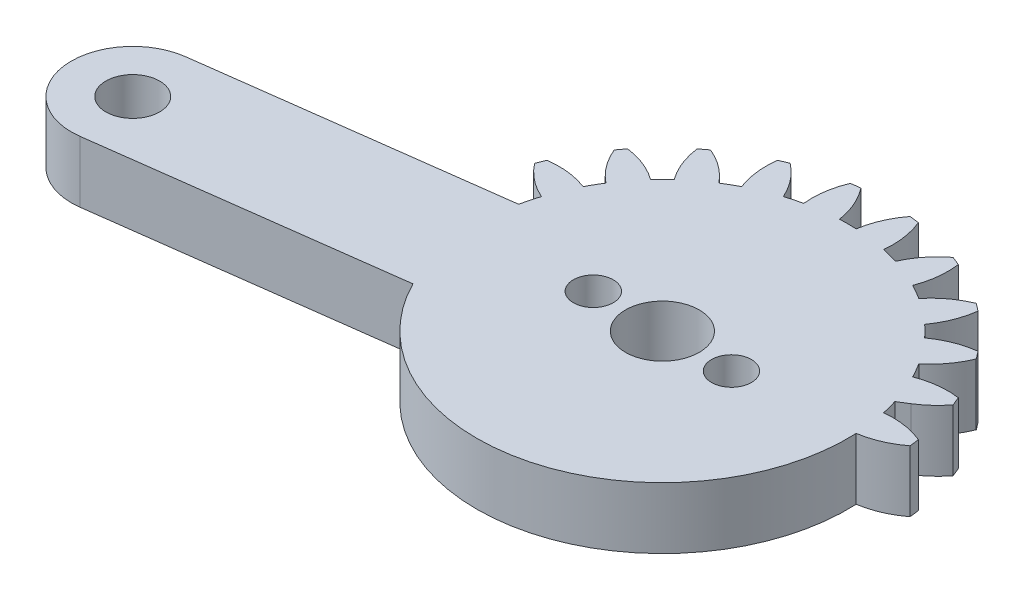
from build123d import *
from build123d.topology import SkipClean

# Parameters (mm, degrees)
SKETCH1_R           = 1.5
BOSS_EXTRUDE1_DEPTH = 4
BOSS_EXTRUDE2_START = -4
SKETCH3_R           = 1.5
SKETCH3_R_2         = 1.75
BOSS_EXTRUDE2_DEPTH = 4
CUT_EXTRUDE1_START  = -4
CUT_EXTRUDE1_DEPTH  = 4
CUT_EXTRUDE2_REACH  = 49.073
SKETCH5_R           = 2.4
SKETCH5_R_2         = 1.3


with BuildPart() as part:
    # Sketch1 → Boss-Extrude1 (new body)
    with BuildSketch(Plane(origin=(0, 0, 0), x_dir=(1, 0, 0), z_dir=(0, 1, 0))):
        with BuildLine():
            Line((20.643657446, 4), (2.081641936, 4))
            ThreePointArc((2.081641936, 4), (2.861028333, 4.588201733), (3.521749436, 5.30713988))
            ThreePointArc((3.521749436, 5.30713988), (3.405395609, 5.596745198), (3.282888305, 5.883801663))
            ThreePointArc((3.282888305, 5.883801663), (1.93527598, 5.894040025), (0.627094961, 5.57027124))
            ThreePointArc((0.627094961, 5.57027124), (0.366286148, 6.046375), (0.084372603, 6.510293938))
            ThreePointArc((0.084372603, 6.510293938), (1.018855105, 7.48132754), (1.683794586, 8.65351323))
            ThreePointArc((1.683794586, 8.65351323), (1.496450048, 8.903135899), (1.303821399, 9.148703928))
            ThreePointArc((1.303821399, 9.148703928), (-0.000522033, 8.809805691), (-1.180330337, 8.158486898))
            ThreePointArc((-1.180330337, 8.158486898), (-1.555477026, 8.550865528), (-1.947855656, 8.926012217))
            ThreePointArc((-1.947855656, 8.926012217), (-1.296536862, 10.105820521), (-0.957638625, 11.410163953))
            ThreePointArc((-0.957638625, 11.410163953), (-1.203206655, 11.602792602), (-1.452829324, 11.79013714))
            ThreePointArc((-1.452829324, 11.79013714), (-2.625015014, 11.125197659), (-3.596048616, 10.190715157))
            ThreePointArc((-3.596048616, 10.190715157), (-4.059967554, 10.472628702), (-4.536071314, 10.733437515))
            ThreePointArc((-4.536071314, 10.733437515), (-4.212302529, 12.041618533), (-4.222540891, 13.389230859))
            ThreePointArc((-4.222540891, 13.389230859), (-4.509597355, 13.511738163), (-4.799202674, 13.62809199))
            ThreePointArc((-4.799202674, 13.62809199), (-5.759348103, 12.682425791), (-6.455432668, 11.528463019))
            ThreePointArc((-6.455432668, 11.528463019), (-6.976508546, 11.680699536), (-7.503891752, 11.809396783))
            ThreePointArc((-7.503891752, 11.809396783), (-7.529737283, 13.156800143), (-7.888414517, 14.455843809))
            ThreePointArc((-7.888414517, 14.455843809), (-8.197396993, 14.499881098), (-8.507248835, 14.537314892))
            ThreePointArc((-8.507248835, 14.537314892), (-9.18992168, 13.375367565), (-9.563620196, 12.080565177))
            ThreePointArc((-9.563620196, 12.080565177), (-10.106342554, 12.09275), (-10.649064912, 12.080565177))
            ThreePointArc((-10.649064912, 12.080565177), (-11.022763428, 13.375367565), (-11.705436272, 14.537314892))
            ThreePointArc((-11.705436272, 14.537314892), (-12.015288115, 14.499881098), (-12.324270591, 14.455843809))
            ThreePointArc((-12.324270591, 14.455843809), (-12.682947825, 13.156800143), (-12.708793355, 11.809396783))
            ThreePointArc((-12.708793355, 11.809396783), (-13.236176561, 11.680699536), (-13.757252439, 11.528463019))
            ThreePointArc((-13.757252439, 11.528463019), (-14.453337005, 12.682425791), (-15.413482434, 13.62809199))
            ThreePointArc((-15.413482434, 13.62809199), (-15.703087752, 13.511738163), (-15.990144217, 13.389230859))
            ThreePointArc((-15.990144217, 13.389230859), (-16.000382579, 12.041618533), (-15.676613793, 10.733437515))
            ThreePointArc((-15.676613793, 10.733437515), (-16.152717554, 10.472628702), (-16.616636492, 10.190715157))
            ThreePointArc((-16.616636492, 10.190715157), (-17.587670094, 11.125197659), (-18.759855783, 11.79013714))
            ThreePointArc((-18.759855783, 11.79013714), (-19.009478453, 11.602792602), (-19.255046482, 11.410163953))
            ThreePointArc((-19.255046482, 11.410163953), (-18.916148245, 10.105820521), (-18.264829452, 8.926012217))
            ThreePointArc((-18.264829452, 8.926012217), (-18.657208082, 8.550865528), (-19.032354771, 8.158486898))
            ThreePointArc((-19.032354771, 8.158486898), (-20.212163074, 8.809805691), (-21.516506507, 9.148703928))
            ThreePointArc((-21.516506507, 9.148703928), (-21.709135156, 8.903135899), (-21.896479694, 8.65351323))
            ThreePointArc((-21.896479694, 8.65351323), (-21.231540213, 7.48132754), (-20.297057711, 6.510293938))
            ThreePointArc((-20.297057711, 6.510293938), (-20.578971255, 6.046375), (-20.839780068, 5.57027124))
            ThreePointArc((-20.839780068, 5.57027124), (-22.147961087, 5.894040025), (-23.495573413, 5.883801663))
            ThreePointArc((-23.495573413, 5.883801663), (-23.618080717, 5.596745198), (-23.734434544, 5.30713988))
            ThreePointArc((-23.734434544, 5.30713988), (-22.788768345, 4.346994451), (-21.634805572, 3.650909885))
            ThreePointArc((-21.634805572, 3.650909885), (-21.78704209, 3.129834008), (-21.915739337, 2.602450802))
            ThreePointArc((-21.915739337, 2.602450802), (-23.263142697, 2.576605271), (-24.562186363, 2.217928037))
            ThreePointArc((-24.562186363, 2.217928037), (-24.606223651, 1.908945561), (-24.643657446, 1.599093719))
            ThreePointArc((-24.643657446, 1.599093719), (-23.481710119, 0.916420874), (-22.186907731, 0.542722358))
            ThreePointArc((-22.186907731, 0.542722358), (-22.199092554, 0), (-22.186907731, -0.542722358))
            ThreePointArc((-22.186907731, -0.542722358), (-23.481710119, -0.916420874), (-24.643657446, -1.599093719))
            ThreePointArc((-24.643657446, -1.599093719), (-24.606223651, -1.908945561), (-24.562186363, -2.217928037))
            ThreePointArc((-24.562186363, -2.217928037), (-23.263142697, -2.576605271), (-21.915739337, -2.602450802))
            ThreePointArc((-21.915739337, -2.602450802), (-21.78704209, -3.129834008), (-21.634805572, -3.650909885))
            ThreePointArc((-21.634805572, -3.650909885), (-22.788768345, -4.346994451), (-23.734434544, -5.30713988))
            ThreePointArc((-23.734434544, -5.30713988), (-23.618080717, -5.596745198), (-23.495573413, -5.883801663))
            ThreePointArc((-23.495573413, -5.883801663), (-22.147961087, -5.894040025), (-20.839780068, -5.57027124))
            ThreePointArc((-20.839780068, -5.57027124), (-20.578971255, -6.046375), (-20.297057711, -6.510293938))
            ThreePointArc((-20.297057711, -6.510293938), (-21.231540213, -7.48132754), (-21.896479694, -8.65351323))
            ThreePointArc((-21.896479694, -8.65351323), (-21.709135156, -8.903135899), (-21.516506507, -9.148703928))
            ThreePointArc((-21.516506507, -9.148703928), (-20.212163074, -8.809805691), (-19.032354771, -8.158486898))
            ThreePointArc((-19.032354771, -8.158486898), (-18.657208082, -8.550865528), (-18.264829452, -8.926012217))
            ThreePointArc((-18.264829452, -8.926012217), (-18.916148245, -10.105820521), (-19.255046482, -11.410163953))
            ThreePointArc((-19.255046482, -11.410163953), (-19.009478453, -11.602792602), (-18.759855783, -11.79013714))
            ThreePointArc((-18.759855783, -11.79013714), (-17.587670094, -11.125197659), (-16.616636492, -10.190715157))
            ThreePointArc((-16.616636492, -10.190715157), (-16.152717554, -10.472628702), (-15.676613793, -10.733437515))
            ThreePointArc((-15.676613793, -10.733437515), (-16.000382579, -12.041618533), (-15.990144217, -13.389230859))
            ThreePointArc((-15.990144217, -13.389230859), (-15.703087752, -13.511738163), (-15.413482434, -13.62809199))
            ThreePointArc((-15.413482434, -13.62809199), (-14.453337005, -12.682425791), (-13.757252439, -11.528463019))
            ThreePointArc((-13.757252439, -11.528463019), (-13.236176561, -11.680699536), (-12.708793355, -11.809396783))
            ThreePointArc((-12.708793355, -11.809396783), (-12.682947825, -13.156800143), (-12.324270591, -14.455843809))
            ThreePointArc((-12.324270591, -14.455843809), (-12.015288115, -14.499881098), (-11.705436272, -14.537314892))
            ThreePointArc((-11.705436272, -14.537314892), (-11.022763428, -13.375367565), (-10.649064912, -12.080565177))
            ThreePointArc((-10.649064912, -12.080565177), (-10.106342554, -12.09275), (-9.563620196, -12.080565177))
            ThreePointArc((-9.563620196, -12.080565177), (-9.18992168, -13.375367565), (-8.507248835, -14.537314892))
            ThreePointArc((-8.507248835, -14.537314892), (-8.197396993, -14.499881098), (-7.888414517, -14.455843809))
            ThreePointArc((-7.888414517, -14.455843809), (-7.529737283, -13.156800143), (-7.503891752, -11.809396783))
            ThreePointArc((-7.503891752, -11.809396783), (-6.976508546, -11.680699536), (-6.455432668, -11.528463019))
            ThreePointArc((-6.455432668, -11.528463019), (-5.759348103, -12.682425791), (-4.799202674, -13.62809199))
            ThreePointArc((-4.799202674, -13.62809199), (-4.509597355, -13.511738163), (-4.222540891, -13.389230859))
            ThreePointArc((-4.222540891, -13.389230859), (-4.212302529, -12.041618533), (-4.536071314, -10.733437515))
            ThreePointArc((-4.536071314, -10.733437515), (-4.059967554, -10.472628702), (-3.596048616, -10.190715157))
            ThreePointArc((-3.596048616, -10.190715157), (-2.625015014, -11.125197659), (-1.452829324, -11.79013714))
            ThreePointArc((-1.452829324, -11.79013714), (-1.203206655, -11.602792602), (-0.957638625, -11.410163953))
            ThreePointArc((-0.957638625, -11.410163953), (-1.296536862, -10.105820521), (-1.947855656, -8.926012217))
            ThreePointArc((-1.947855656, -8.926012217), (-1.555477026, -8.550865528), (-1.180330337, -8.158486898))
            ThreePointArc((-1.180330337, -8.158486898), (-0.000522033, -8.809805691), (1.303821399, -9.148703928))
            ThreePointArc((1.303821399, -9.148703928), (1.496450048, -8.903135899), (1.683794586, -8.65351323))
            ThreePointArc((1.683794586, -8.65351323), (1.018855105, -7.48132754), (0.084372603, -6.510293938))
            ThreePointArc((0.084372603, -6.510293938), (0.366286148, -6.046375), (0.627094961, -5.57027124))
            ThreePointArc((0.627094961, -5.57027124), (1.93527598, -5.894040025), (3.282888305, -5.883801663))
            ThreePointArc((3.282888305, -5.883801663), (3.405395609, -5.596745198), (3.521749436, -5.30713988))
            ThreePointArc((3.521749436, -5.30713988), (2.861028333, -4.588201733), (2.081641936, -4))
            Line((2.081641936, -4), (20.643657446, -4))
            ThreePointArc((20.643657446, -4), (24.643657446, 0), (20.643657446, 4))
        make_face()
        with Locations((-10.106342554, 0)):
            Circle(SKETCH1_R, mode=Mode.SUBTRACT)
        with Locations((20.643657446, 0)):
            Circle(SKETCH1_R, mode=Mode.SUBTRACT)
    extrude(amount=BOSS_EXTRUDE1_DEPTH)

    # Sketch3 → Boss-Extrude2 (add)
    with BuildSketch(Plane(origin=(0, 4, 0), x_dir=(1, 0, 0), z_dir=(0, 1, 0)).offset(BOSS_EXTRUDE2_START)):
        with BuildLine():
            Line((-10.628447323, 3.965779445), (-41.11537681, -0.047900965))
            ThreePointArc((-41.11537681, -0.047900965), (-44.559051487, -4.53578518), (-40.071167272, -7.979459856))
            Line((-40.071167272, -7.979459856), (-9.584237785, -3.965779445))
            ThreePointArc((-9.584237785, -3.965779445), (-6.140563108, 0.522104769), (-10.628447323, 3.965779445))
        make_face()
        with Locations((-10.106342554, 0)):
            Circle(SKETCH3_R, mode=Mode.SUBTRACT)
        with Locations((-40.593272041, -4.013680411)):
            Circle(SKETCH3_R_2, mode=Mode.SUBTRACT)
    extrude(amount=BOSS_EXTRUDE2_DEPTH)

    # Sketch4 → Cut-Extrude1 (cut)
    with SkipClean():  # the faces are left unmerged after this step: merging them gives an invalid solid
        with BuildSketch(Plane(origin=(0, 4, 0), x_dir=(1, 0, 0), z_dir=(0, 1, 0)).offset(CUT_EXTRUDE1_START)):
            with BuildLine():
                ThreePointArc((20.643657446, -4), (24.643657446, 0), (20.643657446, 4))
                Line((20.643657446, 4), (2.081641936, 4))
                Line((2.081641936, 4), (1.43808022, 3.600125745))
                ThreePointArc((1.43808022, 3.600125745), (1.581217534, 3.104116905), (1.70305423, 2.602450802))
                ThreePointArc((1.70305423, 2.602450802), (3.050457589, 2.576605271), (4.349501255, 2.217928037))
                ThreePointArc((4.349501255, 2.217928037), (4.393538544, 1.908945561), (4.430972339, 1.599093719))
                ThreePointArc((4.430972339, 1.599093719), (3.269025011, 0.916420874), (1.974222624, 0.542722358))
                ThreePointArc((1.974222624, 0.542722358), (1.70305423, -2.602450802), (0.627094961, -5.57027124))
                ThreePointArc((0.627094961, -5.57027124), (1.93527598, -5.894040025), (3.282888305, -5.883801663))
                ThreePointArc((3.282888305, -5.883801663), (3.405395609, -5.596745198), (3.521749436, -5.30713988))
                ThreePointArc((3.521749436, -5.30713988), (2.861028333, -4.588201733), (2.081641936, -4))
                Line((2.081641936, -4), (20.643657446, -4))
            make_face()
            with BuildLine():
                ThreePointArc((1.683794586, -8.65351323), (1.018855105, -7.48132754), (0.084372603, -6.510293938))
                ThreePointArc((0.084372603, -6.510293938), (-0.512518948, -7.361599771), (-1.180330337, -8.158486898))
                ThreePointArc((-1.180330337, -8.158486898), (-0.000522033, -8.809805691), (1.303821399, -9.148703928))
                ThreePointArc((1.303821399, -9.148703928), (1.496450048, -8.903135899), (1.683794586, -8.65351323))
            make_face()
            with BuildLine():
                ThreePointArc((-0.957638625, -11.410163953), (-1.296536862, -10.105820521), (-1.947855656, -8.926012217))
                ThreePointArc((-1.947855656, -8.926012217), (-2.744742783, -9.593823606), (-3.596048616, -10.190715157))
                ThreePointArc((-3.596048616, -10.190715157), (-2.625015014, -11.125197659), (-1.452829324, -11.79013714))
                ThreePointArc((-1.452829324, -11.79013714), (-1.203206655, -11.602792602), (-0.957638625, -11.410163953))
            make_face()
            with BuildLine():
                ThreePointArc((-4.222540891, -13.389230859), (-4.212302529, -12.041618533), (-4.536071314, -10.733437515))
                ThreePointArc((-4.536071314, -10.733437515), (-5.478647477, -11.172244217), (-6.455432668, -11.528463019))
                ThreePointArc((-6.455432668, -11.528463019), (-5.759348103, -12.682425791), (-4.799202674, -13.62809199))
                ThreePointArc((-4.799202674, -13.62809199), (-4.509597355, -13.511738163), (-4.222540891, -13.389230859))
            make_face()
            with BuildLine():
                ThreePointArc((-7.888414517, -14.455843809), (-7.529737283, -13.156800143), (-7.503891752, -11.809396783))
                ThreePointArc((-7.503891752, -11.809396783), (-8.527921943, -11.989294847), (-9.563620196, -12.080565177))
                ThreePointArc((-9.563620196, -12.080565177), (-9.18992168, -13.375367565), (-8.507248835, -14.537314892))
                ThreePointArc((-8.507248835, -14.537314892), (-8.197396993, -14.499881098), (-7.888414517, -14.455843809))
            make_face()
            with BuildLine():
                ThreePointArc((-11.705436272, -14.537314892), (-11.022763428, -13.375367565), (-10.649064912, -12.080565177))
                ThreePointArc((-10.649064912, -12.080565177), (-11.684763165, -11.989294847), (-12.708793355, -11.809396783))
                ThreePointArc((-12.708793355, -11.809396783), (-12.682947825, -13.156800143), (-12.324270591, -14.455843809))
                ThreePointArc((-12.324270591, -14.455843809), (-12.015288115, -14.499881098), (-11.705436272, -14.537314892))
            make_face()
            with BuildLine():
                ThreePointArc((-15.413482434, -13.62809199), (-14.453337005, -12.682425791), (-13.757252439, -11.528463019))
                ThreePointArc((-13.757252439, -11.528463019), (-14.734037631, -11.172244217), (-15.676613793, -10.733437515))
                ThreePointArc((-15.676613793, -10.733437515), (-16.000382579, -12.041618533), (-15.990144217, -13.389230859))
                ThreePointArc((-15.990144217, -13.389230859), (-15.703087752, -13.511738163), (-15.413482434, -13.62809199))
            make_face()
            with BuildLine():
                ThreePointArc((-18.759855783, -11.79013714), (-17.587670094, -11.125197659), (-16.616636492, -10.190715157))
                ThreePointArc((-16.616636492, -10.190715157), (-17.467942324, -9.593823606), (-18.264829452, -8.926012217))
                ThreePointArc((-18.264829452, -8.926012217), (-18.916148245, -10.105820521), (-19.255046482, -11.410163953))
                ThreePointArc((-19.255046482, -11.410163953), (-19.009478453, -11.602792602), (-18.759855783, -11.79013714))
            make_face()
            with BuildLine():
                ThreePointArc((-21.516506507, -9.148703928), (-20.212163074, -8.809805691), (-19.032354771, -8.158486898))
                ThreePointArc((-19.032354771, -8.158486898), (-19.70016616, -7.361599771), (-20.297057711, -6.510293938))
                ThreePointArc((-20.297057711, -6.510293938), (-21.231540213, -7.48132754), (-21.896479694, -8.65351323))
                ThreePointArc((-21.896479694, -8.65351323), (-21.709135156, -8.903135899), (-21.516506507, -9.148703928))
            make_face()
            with BuildLine():
                ThreePointArc((-21.942853375, 2.47620963), (-21.92946485, 2.539366405), (-21.915739337, 2.602450802))
                ThreePointArc((-21.915739337, 2.602450802), (-23.263142697, 2.576605271), (-24.562186363, 2.217928037))
                ThreePointArc((-24.562186363, 2.217928037), (-24.56889027, 2.173784387), (-24.575459377, 2.129620475))
                Line((-24.575459377, 2.129620475), (-21.942853375, 2.47620963))
            make_face()
            with BuildLine():
                ThreePointArc((-23.495573413, -5.883801663), (-22.147961087, -5.894040025), (-20.839780068, -5.57027124))
                ThreePointArc((-20.839780068, -5.57027124), (-20.869365339, -5.512888815), (-20.898643838, -5.455349261))
                Line((-20.898643838, -5.455349261), (-23.531249839, -5.801938416))
                ThreePointArc((-23.531249839, -5.801938416), (-23.513474108, -5.842897269), (-23.495573413, -5.883801663))
            make_face()
        extrude(amount=CUT_EXTRUDE1_DEPTH, mode=Mode.SUBTRACT)

    # Sketch5 → Cut-Extrude2 (cut, up to next)
    with BuildSketch(Plane(origin=(0, 4, 0), x_dir=(1, 0, 0), z_dir=(0, 1, 0)), mode=Mode.PRIVATE) as cut_extrude2_sk1:
        with Locations((-10.106342554, 0)):
            Circle(SKETCH5_R)
    cut_extrude2_tool1 = extrude(cut_extrude2_sk1.sketch, amount=-CUT_EXTRUDE2_REACH, mode=Mode.PRIVATE) & part.part
    # Sketch5 → Cut-Extrude2 (cut, up to next)
    with BuildSketch(Plane(origin=(0, 4, 0), x_dir=(1, 0, 0), z_dir=(0, 1, 0)), mode=Mode.PRIVATE) as cut_extrude2_sk2:
        with Locations((-5.606342554, 0)):
            Circle(SKETCH5_R_2)
    cut_extrude2_tool2 = extrude(cut_extrude2_sk2.sketch, amount=-CUT_EXTRUDE2_REACH, mode=Mode.PRIVATE) & part.part
    # Sketch5 → Cut-Extrude2 (cut, up to next)
    with BuildSketch(Plane(origin=(0, 4, 0), x_dir=(1, 0, 0), z_dir=(0, 1, 0)), mode=Mode.PRIVATE) as cut_extrude2_sk3:
        with Locations((-14.606342554, 0)):
            Circle(SKETCH5_R_2)
    cut_extrude2_tool3 = extrude(cut_extrude2_sk3.sketch, amount=-CUT_EXTRUDE2_REACH, mode=Mode.PRIVATE) & part.part
    add(cut_extrude2_tool1.solids().sort_by_distance((-10.106343, 4, 0))[0], mode=Mode.SUBTRACT)
    add(cut_extrude2_tool2.solids().sort_by_distance((-5.606343, 4, 0))[0], mode=Mode.SUBTRACT)
    add(cut_extrude2_tool3.solids().sort_by_distance((-14.606343, 4, 0))[0], mode=Mode.SUBTRACT)


solid = part.part
